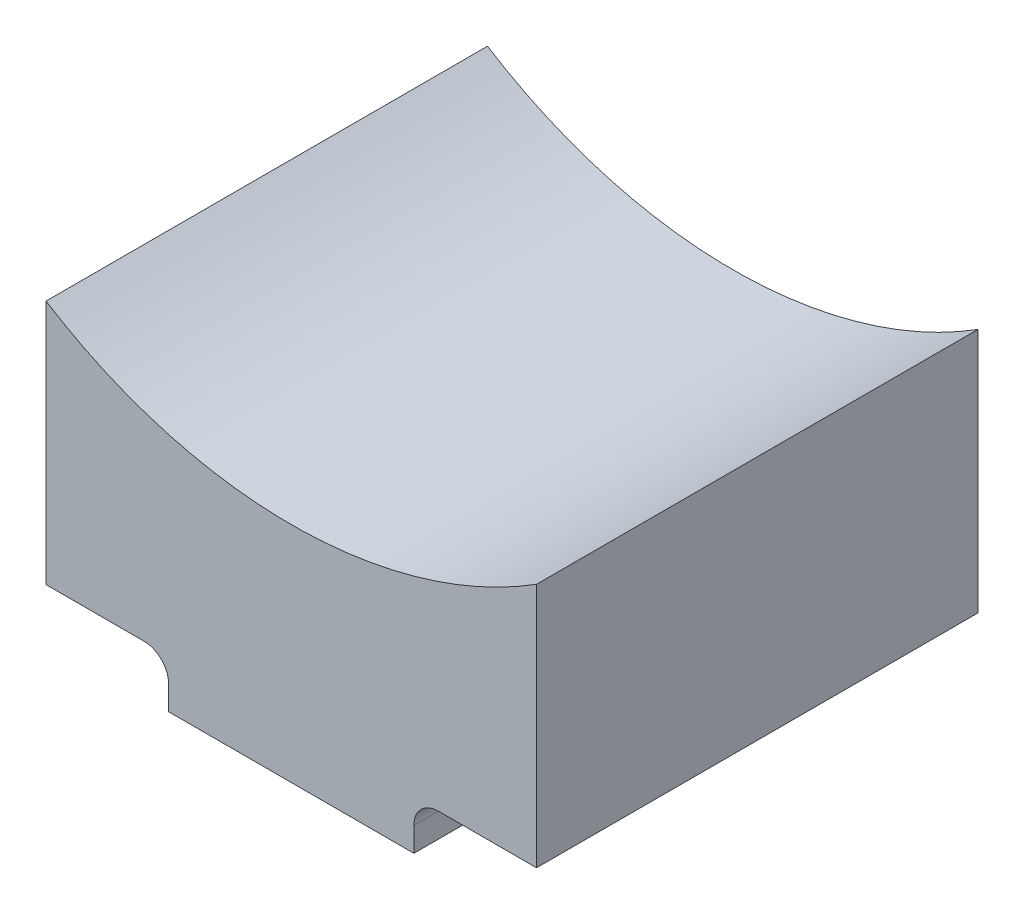
from build123d import *

# Parameters (mm, degrees)
BOSS_EXTRUDE1_DEPTH = 9


with BuildPart() as part:
    # Sketch1 → Boss-Extrude1 (new, symmetric)
    with BuildSketch(Plane.XY):
        with BuildLine():
            Line((10, 3.992849301), (10, -6.01853916))
            Line((10, -6.01853916), (6, -6.01853916))
            ThreePointArc((6, -6.01853916), (5.292893219, -6.311432379), (5, -7.01853916))
            Line((5, -7.01853916), (5, -8.007150699))
            Line((5, -8.007150699), (-5, -8.007150699))
            Line((-5, -8.007150699), (-5, -7.01853916))
            ThreePointArc((-5, -7.01853916), (-5.292893219, -6.311432379), (-6, -6.01853916))
            Line((-6, -6.01853916), (-10, -6.01853916))
            Line((-10, -6.01853916), (-10, 3.992849301))
            ThreePointArc((-10, 3.992849301), (0, 1.100511346), (10, 3.992849301))
        make_face()
    extrude(amount=BOSS_EXTRUDE1_DEPTH, both=True)


solid = part.part
